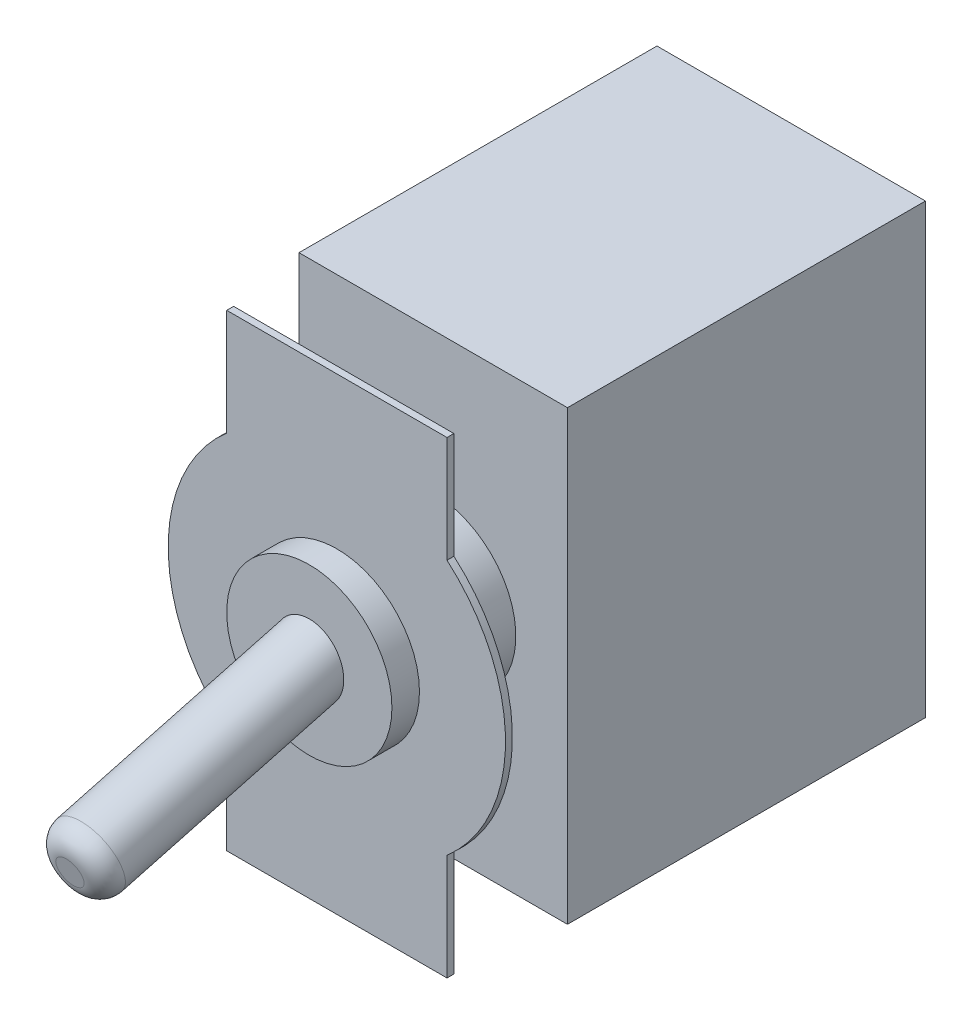
from build123d import *

# Parameters (mm, degrees)
SKETCH1_W           = 19.5
SKETCH1_H           = 32.5
BOSS_EXTRUDE1_DEPTH = 26
SKETCH2_R           = 6
BOSS_EXTRUDE2_DEPTH = 9
BOSS_EXTRUDE3_START = -2
BOSS_EXTRUDE3_DEPTH = 0.5
SWEEP1_OUTLINE_W    = 2.5
SWEEP1_OUTLINE_H    = 18.679041634
FILLET1_R           = 1.5


# Read off the part's stored shape, not the designer's step: Sweep1
with BuildPart() as part:
    # Sketch1 → Boss-Extrude1 (new body)
    with BuildSketch(Plane.XY):
        Rectangle(SKETCH1_W, SKETCH1_H)
    extrude(amount=BOSS_EXTRUDE1_DEPTH)

    # Sketch2 → Boss-Extrude2 (add)
    with BuildSketch(Plane.XY.offset(26)):
        with Locations(Location((0, 0, 0), (0, 0, 180))):
            Circle(SKETCH2_R)
    extrude(amount=BOSS_EXTRUDE2_DEPTH)

    # Sketch3 → Boss-Extrude3 (add)
    with BuildSketch(Plane.XY.offset(35).offset(BOSS_EXTRUDE3_START)):
        with BuildLine():
            Line((8, 9.276987658), (8, 17))
            Line((8, 17), (-8, 17))
            Line((-8, 17), (-8, 9.276987658))
            ThreePointArc((-8, 9.276987658), (-12.25, 0), (-8, -9.276987658))
            Line((-8, -9.276987658), (-8, -17))
            Line((-8, -17), (8, -17))
            Line((8, -17), (8, -9.276987658))
            ThreePointArc((8, -9.276987658), (12.25, 0), (8, 9.276987658))
        make_face()
    extrude(amount=-BOSS_EXTRUDE3_DEPTH)

    # Sweep1 outline → Sweep1 (revolve)
    with BuildSketch(Plane(origin=(0, 8.75, 2.344555434), x_dir=(1, 0, 0), z_dir=(0, 0.965925826289068, 0.258819045102522))):
        with Locations((1.25, -42.467883103)):
            Rectangle(SWEEP1_OUTLINE_W, SWEEP1_OUTLINE_H)
    revolve(axis=Axis((0, 8.75, 2.344555434), (0, 0.258819045102522, -0.965925826289068)))

    # Fillet1
    fillet1_edges = [part.edges().sort_by_distance(p)[0] for p in [
        (-2.5, -4.658742812, 52.386664873),
    ]]
    fillet(fillet1_edges, radius=FILLET1_R)


solid = part.part
